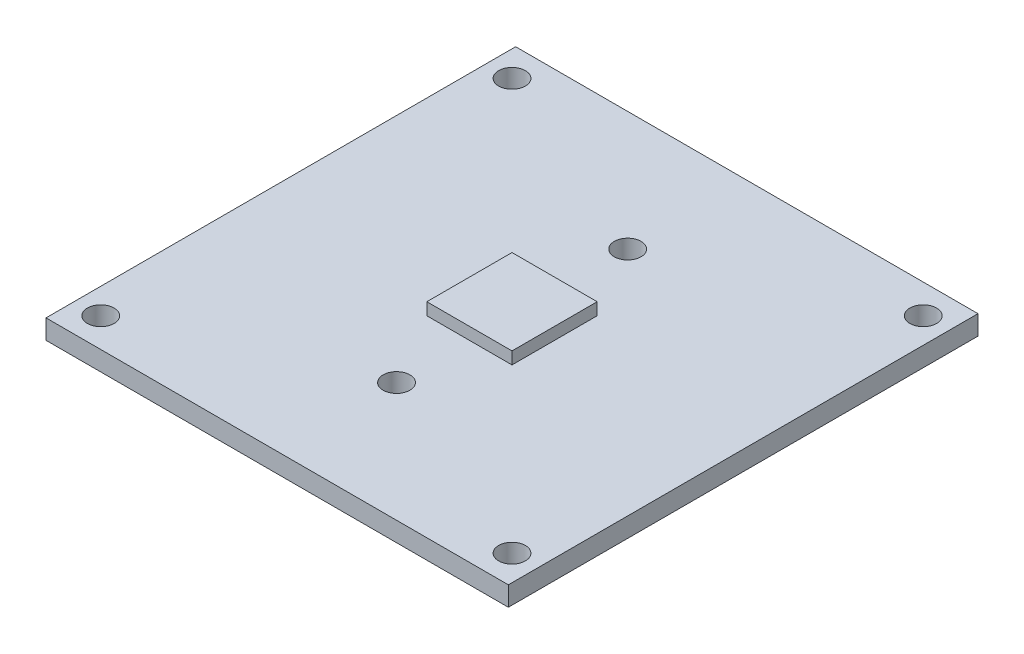
from build123d import *

# Parameters (mm, degrees)
SKETCH1_W           = 38
SKETCH1_H           = 38.6
SKETCH1_R           = 1.1
BOSS_EXTRUDE1_DEPTH = 1.6
BOSS_EXTRUDE2_START = -2.3
SKETCH1_3_W         = 32
SKETCH1_3_H         = 28.6
SKETCH1_3_R         = 1.1
BOSS_EXTRUDE2_DEPTH = 2.3
SKETCH2_W           = 7
SKETCH2_H           = 7
BOSS_EXTRUDE4_DEPTH = 1


with BuildPart() as part:
    # Sketch1 → Boss-Extrude1 (new body)
    with BuildSketch(Plane(origin=(0, 0, 0), x_dir=(1, 0, 0), z_dir=(0, 1, 0))):
        Rectangle(SKETCH1_W, SKETCH1_H)
        with Locations((0.008140781, -9.5)):
            Circle(SKETCH1_R, mode=Mode.SUBTRACT)
        with Locations((0.008140781, 9.5)):
            Circle(SKETCH1_R, mode=Mode.SUBTRACT)
        with Locations((-16.9, -16.9)):
            Circle(SKETCH1_R, mode=Mode.SUBTRACT)
        with Locations((16.9, -16.9)):
            Circle(SKETCH1_R, mode=Mode.SUBTRACT)
        with Locations((-16.9, 16.9)):
            Circle(SKETCH1_R, mode=Mode.SUBTRACT)
        with Locations((16.9, 16.9)):
            Circle(SKETCH1_R, mode=Mode.SUBTRACT)
    extrude(amount=BOSS_EXTRUDE1_DEPTH)

    # Sketch1<3> → Boss-Extrude2 (add)
    with BuildSketch(Plane(origin=(0, 0, 0), x_dir=(1, 0, 0), z_dir=(0, 1, 0)).offset(BOSS_EXTRUDE2_START)):
        Rectangle(SKETCH1_3_W, SKETCH1_3_H)
        with Locations((0.008140781, -9.5)):
            Circle(SKETCH1_3_R, mode=Mode.SUBTRACT)
        with Locations((0.008140781, 9.5)):
            Circle(SKETCH1_3_R, mode=Mode.SUBTRACT)
    extrude(amount=BOSS_EXTRUDE2_DEPTH)

    # Sketch2 → Boss-Extrude4 (add)
    with BuildSketch(Plane(origin=(0, 1.6, 0), x_dir=(1, 0, 0), z_dir=(0, 1, 0))):
        Rectangle(SKETCH2_W, SKETCH2_H)
    extrude(amount=BOSS_EXTRUDE4_DEPTH)


solid = part.part
